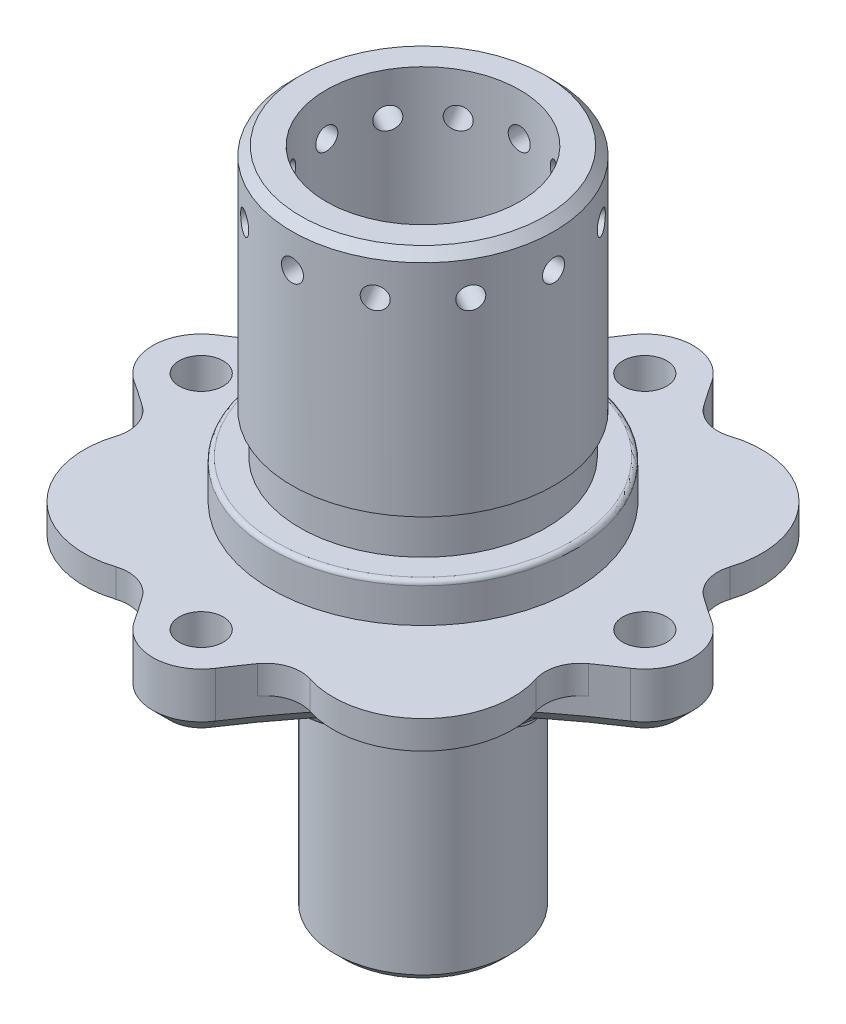
from build123d import *

# Parameters (mm, degrees)
DRIVE_PIN_HOLES_D             = 7.9375
DRIVE_PIN_HOLES_PATTERN_COUNT = 4
FLANGE_START                  = -6.35
SKETCH8_R                     = 52.3875
FLANGE_SUPPORT_CUT_DEPTH      = 6.35
SKETCH9_R                     = 52.3875
FLORAL_PATTERN_CUT_DEPTH      = 96.741386656
SKETCH10_R                    = 25.0825
BRAKE_HAT_HEX_DEPTH           = 4.7625
F_5_16_CLEARANCE_HOLE1_D      = 8.2042
BRAKE_HAT_FILLET_R            = 3.175
HUB_FILLET_R                  = 0.79375
SKETCH14_R                    = 1.984375
PIN_HOLES_DEPTH               = 97.111729302
PIN_HOLE_PATTERN_COUNT        = 12
FLORAL_PATTERN_CHAMFER_SIZE   = 3.175
FLORAL_PATTERN_FILLET_R       = 6.35
FLANGE_FILLET_R               = 1.27
CUT_EXTRUDE1_DEPTH            = 12.954


with BuildPart() as part:
    # Sketch1 → Bearing Shaft/Flange Support (revolve)
    with BuildSketch(Plane(origin=(0, 0, 0), x_dir=(0, 0, -1), z_dir=(1, 0, 0))):
        Polygon((0, 0), (-26.579283315, 0), (-25.0825, -8.48868), (-25.0825, -13.25118), (-15.8877, -13.25118), (-15.8877, -51.28768), (-14.3002, -52.87518), (0, -52.87518), align=None)
    revolve(axis=Axis((0, 0, 0), (0, 1, 0)))

    # Sketch2 → Drive Pin Support (revolve)
    with BuildSketch(Plane(origin=(0, 0, 0), x_dir=(0, 0, -1), z_dir=(1, 0, 0))):
        Polygon((0, 0), (-52.3875, 0), (-52.3875, 11.43), (-27.4096, 11.43), (-27.4096, 18.43), (-22.225, 18.43), (-22.225, 25.7175), (-23.61946, 25.7175), (-23.61946, 65.405), (-22.03196, 66.9925), (0, 66.9925), align=None)
    revolve(axis=Axis((0, 0, 0), (0, 1, 0)))

    # Sketch5 → Center Mass Removal (revolve, cut)
    with BuildSketch(Plane(origin=(0, 0, 0), x_dir=(0, 0, -1), z_dir=(1, 0, 0))):
        Polygon((0, 66.9925), (17.4625, 66.9925), (17.4625, 19.3675), (12.7, -12.3825), (0, -12.3825), align=None)
    revolve(axis=Axis((0, 0, 0), (0, -1, 0)), mode=Mode.SUBTRACT)

    # Drive Pin Holes (through all)
    with Locations(Plane(origin=(0, 0, 0), x_dir=(-1, 0, 0), z_dir=(0, -1, 0))):
        with Locations((0, -40)):
            drive_pin_holes = Hole(DRIVE_PIN_HOLES_D / 2)

    # Drive Pin Holes Pattern: Drive Pin Holes ×4 about axis
    drive_pin_holes_pattern_axis = Axis((0, 0, 0), (0, -1, 0))
    for i in range(1, DRIVE_PIN_HOLES_PATTERN_COUNT):
        add(drive_pin_holes.rotate(drive_pin_holes_pattern_axis, i * 360 / DRIVE_PIN_HOLES_PATTERN_COUNT), mode=Mode.SUBTRACT)

    # Sketch8 → Flange Support Cut (cut)
    with BuildSketch(Plane.XZ.offset(FLANGE_START)):
        Circle(SKETCH8_R)
        with BuildLine():
            ThreePointArc((-7.324939653, 44.751840238), (0, 48.73125), (7.324939653, 44.751840238))
            ThreePointArc((7.324939653, 44.751840238), (24.066955211, 24.066955211), (44.751840238, 7.324939653))
            ThreePointArc((44.751840238, 7.324939653), (48.73125, 0), (44.751840238, -7.324939653))
            ThreePointArc((44.751840238, -7.324939653), (24.066955211, -24.066955211), (7.324939653, -44.751840238))
            ThreePointArc((7.324939653, -44.751840238), (0, -48.73125), (-7.324939653, -44.751840238))
            ThreePointArc((-7.324939653, -44.751840238), (-24.066955211, -24.066955211), (-44.751840238, -7.324939653))
            ThreePointArc((-44.751840238, -7.324939653), (-48.73125, 0), (-44.751840238, 7.324939653))
            ThreePointArc((-44.751840238, 7.324939653), (-24.066955211, 24.066955211), (-7.324939653, 44.751840238))
        make_face(mode=Mode.SUBTRACT)
    extrude(amount=FLANGE_SUPPORT_CUT_DEPTH, mode=Mode.SUBTRACT)

    # Sketch9 → Floral Pattern Cut (cut, through all)
    with BuildSketch(Plane.XZ.offset(-6.35)):
        Circle(SKETCH9_R)
        with BuildLine():
            ThreePointArc((-44.751840238, -7.324939653), (-48.73125, 0), (-44.751840238, 7.324939653))
            ThreePointArc((-44.751840238, 7.324939653), (-40.308436767, 10.342864974), (-35.996620051, 13.545979748))
            ThreePointArc((-35.996620051, 13.545979748), (-33.913330801, 33.913330801), (-13.545979748, 35.996620051))
            ThreePointArc((-13.545979748, 35.996620051), (-10.342864974, 40.308436767), (-7.324939653, 44.751840238))
            ThreePointArc((-7.324939653, 44.751840238), (0, 48.73125), (7.324939653, 44.751840238))
            ThreePointArc((7.324939653, 44.751840238), (10.342864974, 40.308436767), (13.545979748, 35.996620051))
            ThreePointArc((13.545979748, 35.996620051), (33.913330801, 33.913330801), (35.996620051, 13.545979748))
            ThreePointArc((35.996620051, 13.545979748), (40.308436767, 10.342864974), (44.751840238, 7.324939653))
            ThreePointArc((44.751840238, 7.324939653), (48.73125, 0), (44.751840238, -7.324939653))
            ThreePointArc((44.751840238, -7.324939653), (40.308436767, -10.342864974), (35.996620051, -13.545979748))
            ThreePointArc((35.996620051, -13.545979748), (33.913330801, -33.913330801), (13.545979748, -35.996620051))
            ThreePointArc((13.545979748, -35.996620051), (10.342864974, -40.308436767), (7.324939653, -44.751840238))
            ThreePointArc((7.324939653, -44.751840238), (0, -48.73125), (-7.324939653, -44.751840238))
            ThreePointArc((-7.324939653, -44.751840238), (-10.342864974, -40.308436767), (-13.545979748, -35.996620051))
            ThreePointArc((-13.545979748, -35.996620051), (-33.913330801, -33.913330801), (-35.996620051, -13.545979748))
            ThreePointArc((-35.996620051, -13.545979748), (-40.308436767, -10.342864974), (-44.751840238, -7.324939653))
        make_face(mode=Mode.SUBTRACT)
    extrude(amount=-FLORAL_PATTERN_CUT_DEPTH, mode=Mode.SUBTRACT)

    # Sketch10 → Brake Hat Hex (cut)
    with BuildSketch(Plane.XZ.offset(13.25118)):
        Circle(SKETCH10_R)
        Polygon((10.102509651, -17.49806), (20.205019303, 0), (10.102509651, 17.49806), (-10.102509651, 17.49806), (-20.205019303, 0), (-10.102509651, -17.49806), align=None, mode=Mode.SUBTRACT)
    extrude(amount=-BRAKE_HAT_HEX_DEPTH, mode=Mode.SUBTRACT)

    # 5/16 Clearance Hole1 (through all)
    with Locations(Plane(origin=(0, -52.87518, 0), x_dir=(-1, 0, 0), z_dir=(0, -1, 0))):
        with Locations((0, 0)):
            Hole(F_5_16_CLEARANCE_HOLE1_D / 2)

    # Brake Hat Fillet
    brake_hat_fillet_edges = [part.edges().sort_by_distance(p)[0] for p in [
        (20.205019303, -10.86993, 0),
        (10.102509651, -10.86993, 17.49806),
        (-10.102509651, -10.86993, 17.49806),
        (-20.205019303, -10.86993, 0),
        (-10.102509651, -10.86993, -17.49806),
        (10.102509651, -10.86993, -17.49806),
    ]]
    fillet(brake_hat_fillet_edges, radius=BRAKE_HAT_FILLET_R)

    # Hub Fillet
    hub_fillet_edges = [part.edges().sort_by_distance(p)[0] for p in [
        (0, 18.43, -27.4096),
    ]]
    fillet(hub_fillet_edges, radius=HUB_FILLET_R)

    # Sketch14 → Pin Holes (cut, through all)
    with BuildSketch(Plane(origin=(0, 0, 0), x_dir=(0, 0, -1), z_dir=(1, 0, 0))):
        with Locations((0, 59.3725)):
            Circle(SKETCH14_R)
    pin_holes = extrude(amount=-PIN_HOLES_DEPTH, mode=Mode.SUBTRACT)

    # Pin Hole Pattern: Pin Holes ×12 about axis
    pin_hole_pattern_axis = Axis((0, 66.9925, 0), (0, 1, 0))
    for i in range(1, PIN_HOLE_PATTERN_COUNT):
        add(pin_holes.rotate(pin_hole_pattern_axis, i * 360 / PIN_HOLE_PATTERN_COUNT), mode=Mode.SUBTRACT)

    # Floral Pattern Chamfer
    floral_pattern_chamfer_edges = [part.edges().sort_by_distance(p)[0] for p in [
        (0, 0, -48.73125),
        (24.066955211, 0, -24.066955211),
        (48.73125, 0, 0),
        (-24.066955211, 0, -24.066955211),
        (-48.73125, 0, 0),
        (-24.066955211, 0, 24.066955211),
        (0, 0, 48.73125),
        (24.066955211, 0, 24.066955211),
    ]]
    chamfer(floral_pattern_chamfer_edges, length=FLORAL_PATTERN_CHAMFER_SIZE)

    # Floral Pattern Fillet
    floral_pattern_fillet_edges = [part.edges().sort_by_distance(p)[0] for p in [
        (-35.996620051, 8.89, 13.545979748),
        (-35.996620051, 8.89, -13.545979748),
        (-13.545979748, 8.89, -35.996620051),
        (13.545979748, 8.89, -35.996620051),
        (35.996620051, 8.89, -13.545979748),
        (35.996620051, 8.89, 13.545979748),
        (-13.545979748, 8.89, 35.996620051),
        (13.545979748, 8.89, 35.996620051),
    ]]
    fillet(floral_pattern_fillet_edges, radius=FLORAL_PATTERN_FILLET_R)

    # Flange Fillet
    flange_fillet_edges = [part.edges().sort_by_distance(p)[0] for p in [
        (0, -8.48868, -25.0825),
    ]]
    fillet(flange_fillet_edges, radius=FLANGE_FILLET_R)

    # Sketch16 → Cut-Extrude1 (cut)
    with BuildSketch(Plane.XZ.offset(52.87518)):
        with BuildLine():
            Line((-1.430724622, 9.951556163), (-0.944909819, 8.456371943))
            ThreePointArc((-0.944909819, 8.456371943), (0, 8.509), (0.944909819, 8.456371943))
            Line((0.944909819, 8.456371943), (1.430724622, 9.951556163))
            ThreePointArc((1.430724622, 9.951556163), (1.485053186, 10.020536008), (1.571148151, 10.037783295))
            ThreePointArc((1.571148151, 10.037783295), (3.139612663, 9.662734206), (4.628975432, 9.044234984))
            ThreePointArc((4.628975432, 9.044234984), (4.688490021, 8.979676285), (4.691897416, 8.891936889))
            Line((4.691897416, 8.891936889), (4.206082614, 7.396752669))
            ThreePointArc((4.206082614, 7.396752669), (5.001464712, 6.883925605), (5.734978818, 6.285944556))
            Line((5.734978818, 6.285944556), (7.006858483, 7.210019223))
            ThreePointArc((7.006858483, 7.210019223), (7.091356551, 7.233891562), (7.171146542, 7.197239559))
            ThreePointArc((7.171146542, 7.197239559), (8.219612663, 5.971898163), (9.060987733, 4.596096312))
            ThreePointArc((9.060987733, 4.596096312), (9.071189395, 4.508885429), (9.022374113, 4.435899949))
            Line((9.022374113, 4.435899949), (7.750494448, 3.511825282))
            ThreePointArc((7.750494448, 3.511825282), (8.092539897, 2.629425605), (8.334480833, 1.7145))
            Line((8.334480833, 1.7145), (9.906610558, 1.7145))
            ThreePointArc((9.906610558, 1.7145), (9.989002739, 1.68414641), (10.032010692, 1.607594937))
            ThreePointArc((10.032010692, 1.607594937), (10.16, 0), (10.032010692, -1.607594937))
            ThreePointArc((10.032010692, -1.607594937), (9.989002739, -1.68414641), (9.906610558, -1.7145))
            Line((9.906610558, -1.7145), (8.334480833, -1.7145))
            ThreePointArc((8.334480833, -1.7145), (8.092539897, -2.629425605), (7.750494448, -3.511825282))
            Line((7.750494448, -3.511825282), (9.022374113, -4.435899949))
            ThreePointArc((9.022374113, -4.435899949), (9.071189395, -4.508885429), (9.060987733, -4.596096312))
            ThreePointArc((9.060987733, -4.596096312), (8.219612663, -5.971898163), (7.171146542, -7.197239559))
            ThreePointArc((7.171146542, -7.197239559), (7.091356551, -7.233891562), (7.006858483, -7.210019223))
            Line((7.006858483, -7.210019223), (5.734978818, -6.285944556))
            ThreePointArc((5.734978818, -6.285944556), (5.001464712, -6.883925605), (4.206082614, -7.396752669))
            Line((4.206082614, -7.396752669), (4.691897416, -8.891936889))
            ThreePointArc((4.691897416, -8.891936889), (4.688490021, -8.979676285), (4.628975432, -9.044234984))
            ThreePointArc((4.628975432, -9.044234984), (3.139612663, -9.662734206), (1.571148151, -10.037783295))
            ThreePointArc((1.571148151, -10.037783295), (1.485053186, -10.020536008), (1.430724622, -9.951556163))
            Line((1.430724622, -9.951556163), (0.944909819, -8.456371943))
            ThreePointArc((0.944909819, -8.456371943), (0, -8.509), (-0.944909819, -8.456371943))
            Line((-0.944909819, -8.456371943), (-1.430724622, -9.951556163))
            ThreePointArc((-1.430724622, -9.951556163), (-1.485053186, -10.020536008), (-1.571148151, -10.037783295))
            ThreePointArc((-1.571148151, -10.037783295), (-3.139612663, -9.662734206), (-4.628975432, -9.044234984))
            ThreePointArc((-4.628975432, -9.044234984), (-4.688490021, -8.979676285), (-4.691897416, -8.891936889))
            Line((-4.691897416, -8.891936889), (-4.206082614, -7.396752669))
            ThreePointArc((-4.206082614, -7.396752669), (-5.001464712, -6.883925605), (-5.734978818, -6.285944556))
            Line((-5.734978818, -6.285944556), (-7.006858483, -7.210019223))
            ThreePointArc((-7.006858483, -7.210019223), (-7.091356551, -7.233891562), (-7.171146542, -7.197239559))
            ThreePointArc((-7.171146542, -7.197239559), (-8.219612663, -5.971898163), (-9.060987733, -4.596096312))
            ThreePointArc((-9.060987733, -4.596096312), (-9.071189395, -4.508885429), (-9.022374113, -4.435899949))
            Line((-9.022374113, -4.435899949), (-7.750494448, -3.511825282))
            ThreePointArc((-7.750494448, -3.511825282), (-8.092539897, -2.629425605), (-8.334480833, -1.7145))
            Line((-8.334480833, -1.7145), (-9.906610558, -1.7145))
            ThreePointArc((-9.906610558, -1.7145), (-9.989002739, -1.68414641), (-10.032010692, -1.607594937))
            ThreePointArc((-10.032010692, -1.607594937), (-10.16, 0), (-10.032010692, 1.607594937))
            ThreePointArc((-10.032010692, 1.607594937), (-9.989002739, 1.68414641), (-9.906610558, 1.7145))
            Line((-9.906610558, 1.7145), (-8.334480833, 1.7145))
            ThreePointArc((-8.334480833, 1.7145), (-8.092539897, 2.629425605), (-7.750494448, 3.511825282))
            Line((-7.750494448, 3.511825282), (-9.022374113, 4.435899949))
            ThreePointArc((-9.022374113, 4.435899949), (-9.071189395, 4.508885429), (-9.060987733, 4.596096312))
            ThreePointArc((-9.060987733, 4.596096312), (-8.219612663, 5.971898163), (-7.171146542, 7.197239559))
            ThreePointArc((-7.171146542, 7.197239559), (-7.091356551, 7.233891562), (-7.006858483, 7.210019223))
            Line((-7.006858483, 7.210019223), (-5.734978818, 6.285944556))
            ThreePointArc((-5.734978818, 6.285944556), (-5.001464712, 6.883925605), (-4.206082614, 7.396752669))
            Line((-4.206082614, 7.396752669), (-4.691897416, 8.891936889))
            ThreePointArc((-4.691897416, 8.891936889), (-4.688490021, 8.979676285), (-4.628975432, 9.044234984))
            ThreePointArc((-4.628975432, 9.044234984), (-3.139612663, 9.662734206), (-1.571148151, 10.037783295))
            ThreePointArc((-1.571148151, 10.037783295), (-1.485053186, 10.020536008), (-1.430724622, 9.951556163))
        make_face()
    extrude(amount=-CUT_EXTRUDE1_DEPTH, mode=Mode.SUBTRACT)


solid = part.part
